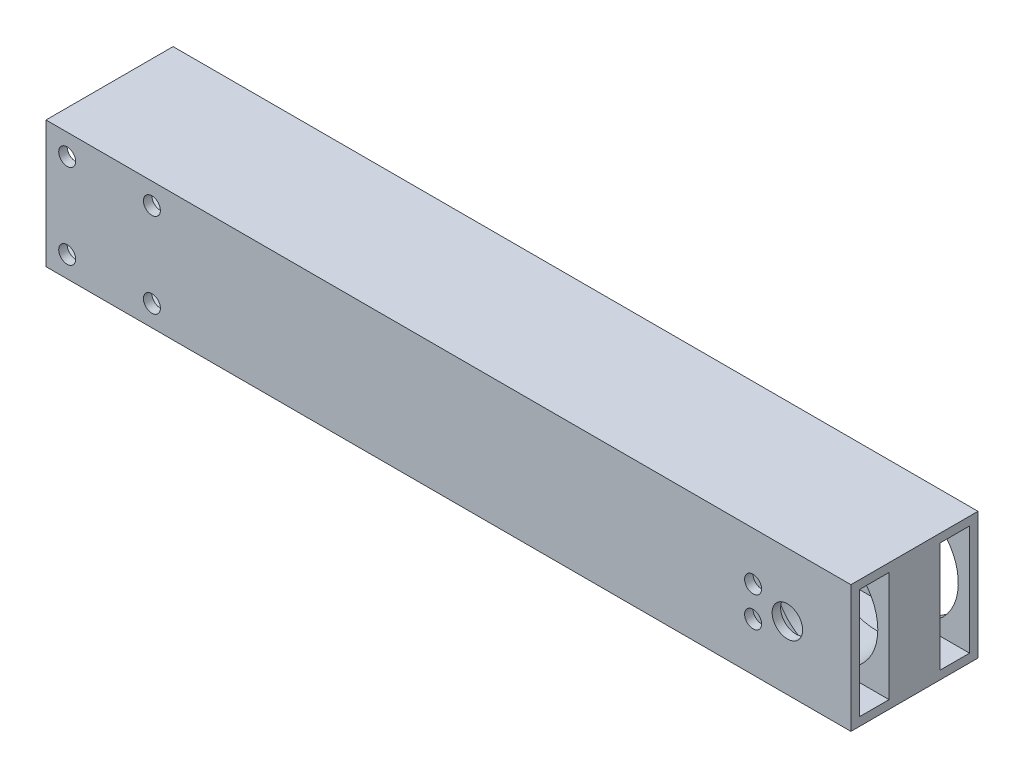
from build123d import *

# Parameters (mm, degrees)
BOSS_EXTRUDE3_DEPTH      = 110
BOSS_EXTRUDE3_DEPTH_BACK = 80
SKETCH1_W                = 30
SKETCH1_H                = 30
SKETCH1_W_2              = 7
SKETCH1_H_2              = 26
SKETCH6_R                = 12.35
CUT_EXTRUDE5_DEPTH       = 23
SKETCH8_R                = 3.6
SKETCH8_R_2              = 2
CUT_EXTRUDE6_DEPTH       = 17
SKETCH9_W                = 12
SKETCH9_H                = 26
CUT_EXTRUDE7_DEPTH       = 106
SKETCH12_R               = 2
CUT_EXTRUDE8_DEPTH       = 40


with BuildPart() as part:
    # Sketch1 → Boss-Extrude3 (new, two sides: drawn at the far end of the back side and taken through both)
    with BuildSketch(Plane(origin=(0, 0, 0), x_dir=(0, 0, -1), z_dir=(1, 0, 0)).offset(-BOSS_EXTRUDE3_DEPTH_BACK)):
        Rectangle(SKETCH1_W, SKETCH1_H)
        with Locations((-9.5, 0)):
            Rectangle(SKETCH1_W_2, SKETCH1_H_2, mode=Mode.SUBTRACT)
        with Locations((9.5, 0)):
            Rectangle(SKETCH1_W_2, SKETCH1_H_2, mode=Mode.SUBTRACT)
    extrude(amount=BOSS_EXTRUDE3_DEPTH + BOSS_EXTRUDE3_DEPTH_BACK)

    # Sketch6 → Cut-Extrude5 (cut)
    with BuildSketch(Plane(origin=(0, 0, -15), x_dir=(-1, 0, 0), z_dir=(0, 0, -1))):
        with Locations((-95, 0)):
            Circle(SKETCH6_R)
    extrude(amount=-CUT_EXTRUDE5_DEPTH, mode=Mode.SUBTRACT)

    # Sketch8 → Cut-Extrude6 (cut)
    with BuildSketch(Plane.XY.offset(15)):
        with Locations((95, 0)):
            Circle(SKETCH8_R)
        with Locations((86.906938117, 3.581179883)):
            Circle(SKETCH8_R_2)
        with Locations((86.906938117, -3.581179883)):
            Circle(SKETCH8_R_2)
    extrude(amount=-CUT_EXTRUDE6_DEPTH, mode=Mode.SUBTRACT)

    # Sketch9 → Cut-Extrude7 (cut)
    with BuildSketch(Plane.ZY.offset(80)):
        Rectangle(SKETCH9_W, SKETCH9_H)
    extrude(amount=-CUT_EXTRUDE7_DEPTH, mode=Mode.SUBTRACT)

    # Sketch12 → Cut-Extrude8 (cut)
    with BuildSketch(Plane.XY.offset(15)):
        with Locations((-75, 10)):
            Circle(SKETCH12_R)
        with Locations((-55, 10)):
            Circle(SKETCH12_R)
        with Locations((-75, -10)):
            Circle(SKETCH12_R)
        with Locations((-55, -10)):
            Circle(SKETCH12_R)
    extrude(amount=-CUT_EXTRUDE8_DEPTH, mode=Mode.SUBTRACT)


solid = part.part
